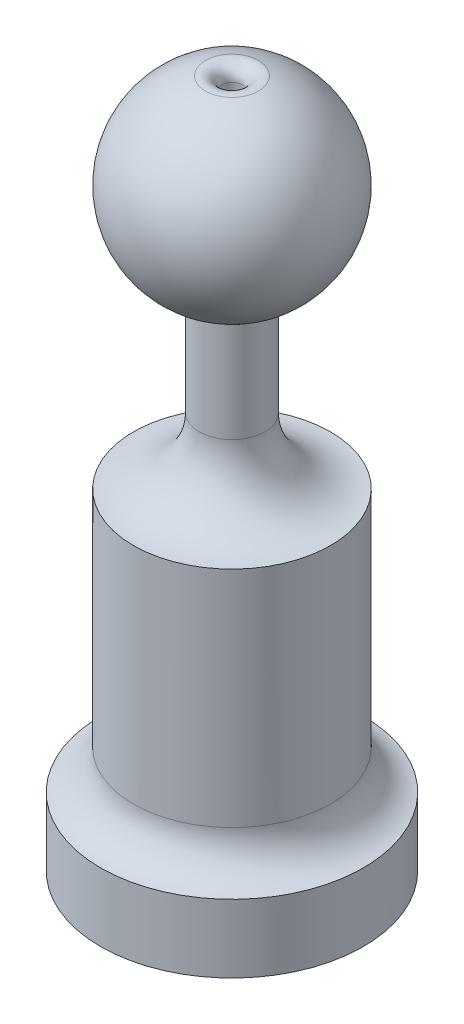
from build123d import *
from build123d.topology import SkipClean

# Parameters (mm, degrees)
SKETCH1_W           = 5.06
SKETCH1_H           = 1.900618781
FILLET1_R           = 1
SKETCH2_R           = 7.5
BOSS_EXTRUDE1_DEPTH = 20
SKETCH3_R           = 5.06
CUT_EXTRUDE1_DEPTH  = 5
SKETCH4_R           = 2.5
BOSS_EXTRUDE2_DEPTH = 20
FILLET2_R           = 5
SKETCH6_R           = 0.75
CUT_EXTRUDE2_DEPTH  = 45
FILLET3_R           = 1
FILLET4_R           = 3


# Some blends are built 0.0001 mm under size
with BuildPart() as part:
    # Sketch1 → Revolve1 (revolve)
    with BuildSketch(Plane.XY, mode=Mode.PRIVATE) as revolve1_sk:
        with Locations((-11.747326196, 6.364372648)):
            Rectangle(SKETCH1_W, SKETCH1_H)
        Polygon((-4.277326196, 2.122680798), (-4.277326196, 7.314682038), (-9.217326196, 7.314682038), (-9.217326196, 5.414063257), (-9.217326196, -0.580054764), align=None)
    revolve(revolve1_sk.sketch.rotate(Axis((-14.277326196, 7.314682038, 0), (0, -1, 0)), 90), axis=Axis((-14.277326196, 7.314682038, 0), (0, -1, 0)))

    # Fillet1
    fillet1_edges = [part.edges().sort_by_distance(p)[0] for p in [
        (-14.277326196, -0.580054764, -5.06),
    ]]
    fillet(fillet1_edges, radius=FILLET1_R)

    # Sketch2 → Boss-Extrude1 (add)
    with BuildSketch(Plane(origin=(0, 7.314682038, 0), x_dir=(1, 0, 0), z_dir=(0, 1, 0))):
        with Locations(Location((-14.277326196, 0, 0), (0, 0, 270))):
            Circle(SKETCH2_R)
    extrude(amount=BOSS_EXTRUDE1_DEPTH)

    # Sketch3 → Cut-Extrude1 (cut)
    with BuildSketch(Plane.XZ.offset(-5.414063257)):
        with Locations(Location((-14.277326196, 0, 0), (0, 0, 270))):
            Circle(SKETCH3_R)
    extrude(amount=-CUT_EXTRUDE1_DEPTH, mode=Mode.SUBTRACT)

    # Sketch4 → Boss-Extrude2 (add)
    with BuildSketch(Plane(origin=(0, 27.314682038, 0), x_dir=(1, 0, 0), z_dir=(0, 1, 0))):
        with Locations(Location((-14.277326196, 0, 0), (0, 0, 270))):
            Circle(SKETCH4_R)
    extrude(amount=BOSS_EXTRUDE2_DEPTH)

    # Sketch5 → Revolve2 (revolve)
    with SkipClean():  # the faces are left unmerged after this step: merging them gives an invalid solid
        with BuildSketch(Plane(origin=(0, 47.314682038, 0), x_dir=(1, 0, 0), z_dir=(0, 1, 0))):
            with BuildLine():
                ThreePointArc((-16.777326196, 0), (-14.277326196, 2.5), (-11.777326196, 0))
                Line((-11.777326196, 0), (-6.777326196, 0))
                ThreePointArc((-6.777326196, 0), (-14.277326196, 7.5), (-21.777326196, 0))
                Line((-21.777326196, 0), (-16.777326196, 0))
            make_face()
            with BuildLine():
                Line((-6.777326196, 0), (-11.777326196, 0))
                ThreePointArc((-11.777326196, 0), (-14.277326196, -2.5), (-16.777326196, 0))
                Line((-16.777326196, 0), (-21.777326196, 0))
                ThreePointArc((-21.777326196, 0), (-14.277326196, -7.5), (-6.777326196, 0))
            make_face()
            with BuildLine():
                ThreePointArc((-16.777326196, 0), (-14.277326196, -2.5), (-11.777326196, 0))
                Line((-11.777326196, 0), (-16.777326196, 0))
            make_face()
            with BuildLine():
                Line((-16.777326196, 0), (-11.777326196, 0))
                ThreePointArc((-11.777326196, 0), (-14.277326196, 2.5), (-16.777326196, 0))
            make_face()
        revolve(axis=Axis((-21.777326196, 47.314682038, 0), (1, 0, 0)))
    add(part.part.scale(1), mode=Mode.REPLACE)  # the faces are merged on a copy

    # Fillet2
    fillet2_edges = [part.edges().sort_by_distance(p)[0] for p in [
        (-14.277326196, 27.314682038, -2.5),
    ]]
    fillet(fillet2_edges, radius=FILLET2_R - 0.0001)  # a hair under: the kernel refuses the full size

    # Sketch6 → Cut-Extrude2 (cut)
    with BuildSketch(Plane.XZ.offset(-10.414063257)):
        with Locations(Location((-14.277326196, 0, 0), (0, 0, 270))):
            Circle(SKETCH6_R)
    extrude(amount=-CUT_EXTRUDE2_DEPTH, mode=Mode.SUBTRACT)

    # Fillet3
    fillet3_edges = [part.edges().sort_by_distance(p)[0] for p in [
        (-14.277326196, 54.777087816, 0.749999995),
    ]]
    fillet(fillet3_edges, radius=FILLET3_R)

    # Fillet4
    # the kernel refuses this fillet: 3 mm, written as the material it adds along each edge
    with BuildSketch(Plane(origin=(-14.277326196, 7.314682038, 0), x_dir=(0, 0, 1), z_dir=(-1, 0, 0))) as fillet4_piece_1:
        with BuildLine():
            CenterArc((10.5, 2.958039892), FILLET4_R, 180, 80.405931773)
            Line((10, 0), (9.99, -0.059160798))
            ThreePointArc((9.99, -0.059160798), (8.75, -0.06), (7.5, -0.06))
            Line((7.5, -0.06), (7.44, 0))
            Line((7.44, 0), (7.44, 2.958039892))
            Line((7.44, 2.958039892), (7.5, 2.958039892))
        make_face()
    revolve(axis=Axis((-14.277326196, 7.314682038, 0), (0, 1, 0)))


solid = part.part
